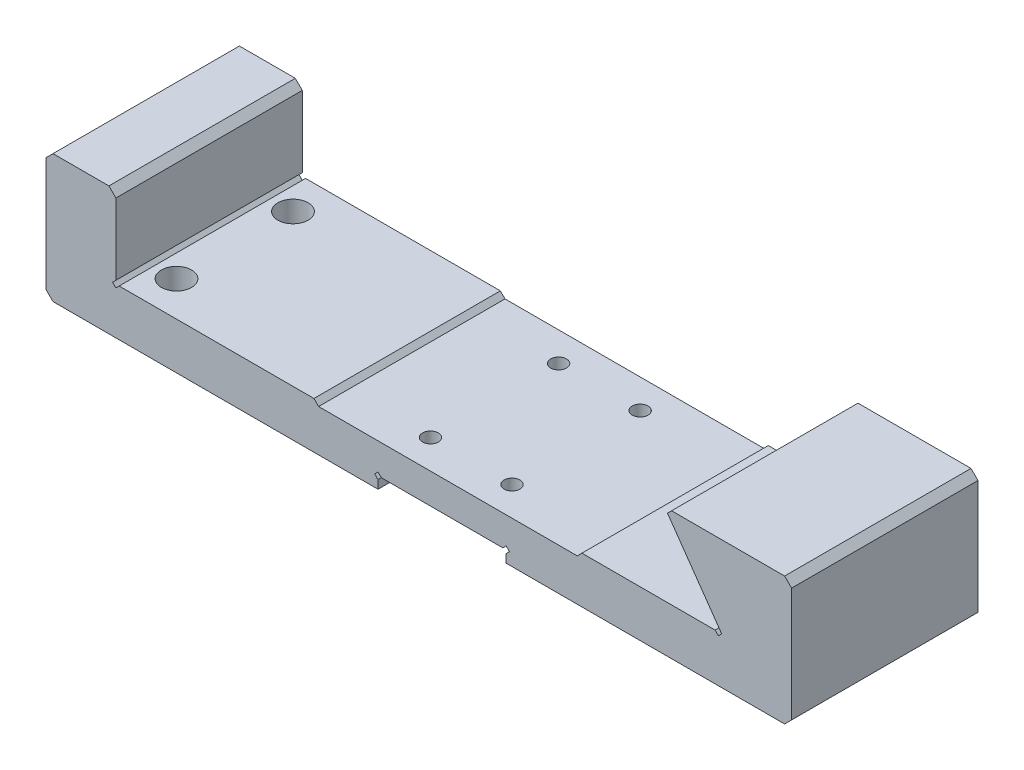
from build123d import *
from OCP.BRepFilletAPI import BRepFilletAPI_MakeChamfer

# Parameters (mm, degrees)
EXTRUDE_1_DEPTH          = 40
CUT_EXTRUDE_1_DEPTH      = 335.402452144
CUT_EXTRUDE_1_DEPTH_BACK = 80
SKETCH_2_W               = 115
SKETCH_2_H               = 2
CHAMFER_1_SIZE           = 2
CUT_EXTRUDE_1_2_DEPTH    = 80
CUT_EXTRUDE_2_DEPTH      = 335.402452144
CUT_EXTRUDE_2_DEPTH_BACK = 80
SKETCH_4_W               = 55
SKETCH_4_H               = 5
CUT_EXTRUDE_2_2_DEPTH    = 80
HOLE_WIZARD_M8_1_D       = 6.8
HOLE_WIZARD_1_D          = 13
CHAMFER_2_SIZE           = 3
CHAMFER_2_SIZE2          = 2.154045129


with BuildPart() as part:
    # 草图1 → 凸台-拉伸1 (new, symmetric)
    with BuildSketch(Plane.XY):
        Polygon((0, 0), (0, 55), (30, 55), (30, 20), (290, 20), (265.492736163, 55), (320, 55), (320, 0), align=None)
    extrude(amount=EXTRUDE_1_DEPTH, both=True)

    # 草图2 → Cut-Extrude 1 (cut, two sides: drawn at the far end of the back side and taken through both)
    with BuildSketch(Plane.XY.offset(40).offset(-CUT_EXTRUDE_1_DEPTH_BACK)):
        with Locations((172.5, 19)):
            Rectangle(SKETCH_2_W, SKETCH_2_H)
    extrude(amount=CUT_EXTRUDE_1_DEPTH + CUT_EXTRUDE_1_DEPTH_BACK, mode=Mode.SUBTRACT)

    # 倒角1
    chamfer_1_edges = [part.edges().sort_by_distance(p)[0] for p in [
        (230, 18, 0),
        (115, 18, 0),
    ]]
    chamfer(chamfer_1_edges, length=CHAMFER_1_SIZE - 0.0001)  # a hair under: the kernel refuses the full size

    # 草图3 → Cut-Extrude 1 2 (cut)
    with BuildSketch(Plane.XY.offset(40)):
        Polygon((287.171572875, 20), (288.585786438, 18.585786438), (290, 20), (288.585786438, 21.414213562), align=None)
        Polygon((28.585786438, 20), (30, 21.414213562), (31.414213562, 20), (30, 18.585786438), align=None)
    extrude(amount=-CUT_EXTRUDE_1_2_DEPTH, mode=Mode.SUBTRACT)

    # 草图4 → Cut-Extrude 2 (cut, two sides: drawn at the far end of the back side and taken through both)
    with BuildSketch(Plane.XY.offset(40).offset(-CUT_EXTRUDE_2_DEPTH_BACK)):
        with Locations((170, 2.5)):
            Rectangle(SKETCH_4_W, SKETCH_4_H)
    extrude(amount=CUT_EXTRUDE_2_DEPTH + CUT_EXTRUDE_2_DEPTH_BACK, mode=Mode.SUBTRACT)

    # 草图5 → Cut-Extrude 2 2 (cut)
    with BuildSketch(Plane.XY.offset(40)):
        Polygon((198.914213562, 5), (197.5, 6.414213562), (196.085786438, 5), (197.5, 3.585786438), align=None)
    cut_extrude_2_2 = extrude(amount=-CUT_EXTRUDE_2_2_DEPTH, mode=Mode.SUBTRACT)

    # 镜向1: Cut-Extrude 2 2 across plane
    add(cut_extrude_2_2.mirror(Plane(origin=(170, 0, 0), x_dir=(0, 0, 1), z_dir=(1, 0, 0))), mode=Mode.SUBTRACT)

    # M8 螺纹孔1 (through all)
    with Locations(Plane.XZ):
        with Locations((152.5, 27.5), (187.5, 27.5), (187.5, -27.5), (152.5, -27.5)):
            Hole(HOLE_WIZARD_M8_1_D / 2)

    # 孔1 (through all)
    with Locations(Plane(origin=(0, 20, 0), x_dir=(1, 0, 0), z_dir=(0, 1, 0))):
        with Locations((41, 25), (41, -25)):
            Hole(HOLE_WIZARD_1_D / 2)

    # 倒角2: one chamfer whose edges measure the first distance from different faces: ONE call of the kernel's chamfer builder (chamfer() names one face for all edges)
    chamfer_2_edges_1 = [part.edges().sort_by_distance(p)[0] for p in [
        (0, 0, 0),
        (0, 55, 0),
        (30, 55, 0),
        (320, 55, 0),
        (320, 0, 0),
    ]]
    chamfer_2_edges_2 = [part.edges().sort_by_distance(p)[0] for p in [
        (265.492736163, 55, 0),
    ]]
    chamfer_2_side_2 = [part.faces().sort_by_distance(p)[0] for p in [
        (292.746368081, 55, 0),
    ]]
    chamfer_2 = BRepFilletAPI_MakeChamfer(part.part.solid().wrapped)
    for e in chamfer_2_edges_1:
        chamfer_2.Add(CHAMFER_2_SIZE, e.wrapped)
    for e in chamfer_2_edges_2:
        chamfer_2.Add(CHAMFER_2_SIZE, CHAMFER_2_SIZE2, e.wrapped, chamfer_2_side_2[0].wrapped)  # the first distance lies on this face
    add(Compound.cast(chamfer_2.Shape()), mode=Mode.REPLACE)


solid = part.part
